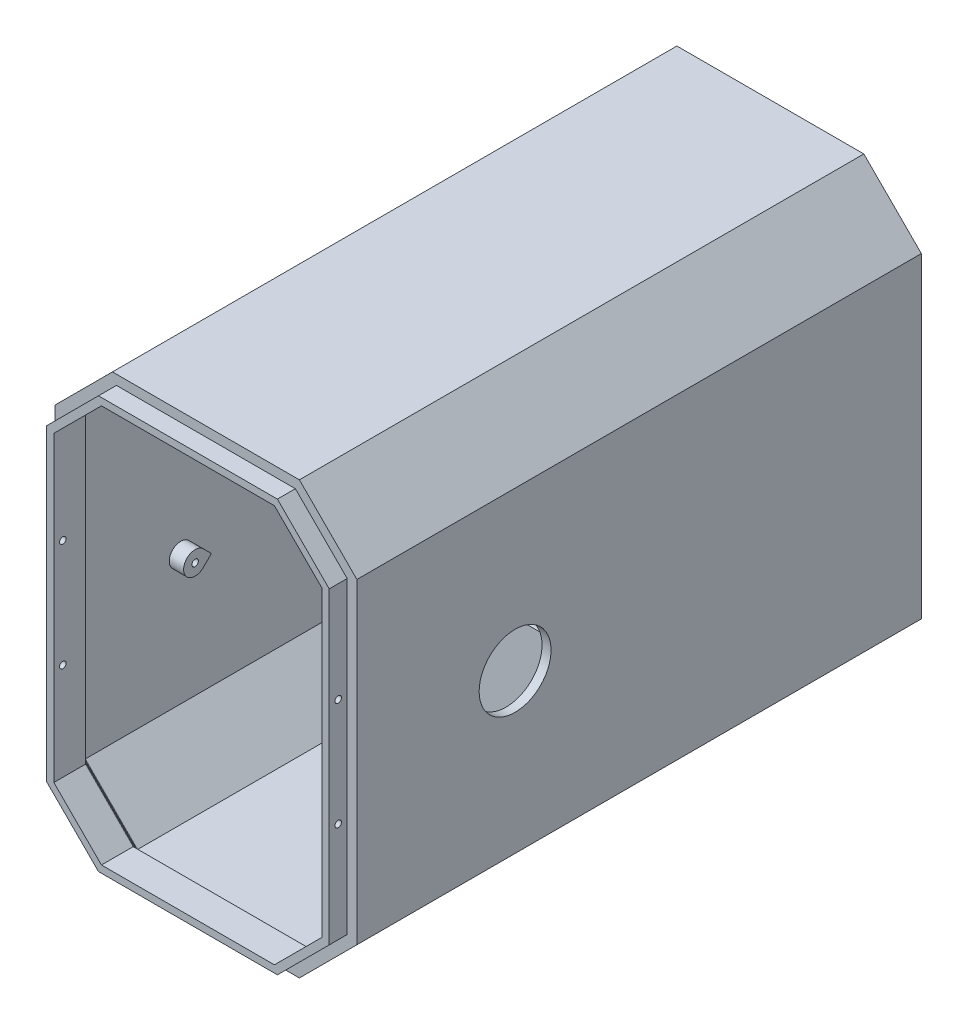
from build123d import *

# Parameters (mm, degrees)
BOSS_1_DEPTH    = 157
CUT_2_DEPTH     = 122.675
CUT_3_DEPTH     = 32.025
S_CUT4_W        = 8
S_CUT4_H        = 28
POCKET_4_DEPTH  = 2.7
S_HOLE5_R       = 6
HOLE_5_DEPTH    = 2.7
S_CUT6_W        = 19.4
S_CUT6_H        = 6.3
POCKET_6_DEPTH  = 2.7
S_CUT7_W        = 19.4
S_CUT7_H        = 6.3
POCKET_7_DEPTH  = 2.7
S_HOLE8_R       = 1.7
HOLE_8_DEPTH    = 2.7
S_HOLE9_R       = 1.7
HOLE_9_DEPTH    = 2.7
S_HOLE10_R      = 1.7
HOLE_10_DEPTH   = 2.7
S_HOLE11_R      = 1.7
HOLE_11_DEPTH   = 2.7
S_CUT12_W       = 10
S_CUT12_H       = 21.5
POCKET_12_DEPTH = 56.3
BOSS_13_DEPTH   = 6
BOSS_14_DEPTH   = 5.1
S_CYL15_R       = 3.2
BOSS_15_DEPTH   = 4.5
BOSS_16_DEPTH   = 4.5
S_CYL17_R       = 3.2
BOSS_17_DEPTH   = 4.5
BOSS_18_DEPTH   = 4.5
S_CYL19_R       = 3.2
BOSS_19_DEPTH   = 4.5
BOSS_20_DEPTH   = 4.5
S_CYL21_R       = 3.2
BOSS_21_DEPTH   = 4.5
BOSS_22_DEPTH   = 4.5
S_BOX23_W       = 25.8
S_BOX23_H       = 69
BOSS_23_DEPTH   = 6
BOSS_24_DEPTH   = 69
CUT_25_DEPTH    = 8.9
CUT_26_DEPTH    = 0.3
CUT_27_DEPTH    = 0.3
CUT_28_DEPTH    = 0.3
CUT_29_DEPTH    = 0.3
CUT_30_DEPTH    = 0.3
CUT_31_DEPTH    = 0.3
CUT_32_DEPTH    = 0.3
CUT_33_DEPTH    = 0.3
CUT_34_DEPTH    = 0.3
CUT_35_DEPTH    = 0.3
CUT_36_DEPTH    = 0.3
S_HOLE37_R      = 0.9
HOLE_37_DEPTH   = 2.7
S_HOLE38_R      = 0.9
HOLE_38_DEPTH   = 2.7
S_HOLE39_R      = 0.9
HOLE_39_DEPTH   = 2.7
S_HOLE40_R      = 0.9
HOLE_40_DEPTH   = 2.7
S_HOLE41_R      = 0.9
HOLE_41_DEPTH   = 5.2
S_HOLE42_R      = 0.9
HOLE_42_DEPTH   = 5.2
S_HOLE43_R      = 0.9
HOLE_43_DEPTH   = 5.2
S_HOLE44_R      = 0.9
HOLE_44_DEPTH   = 5.2
S_HOLE45_R      = 10
HOLE_45_DEPTH   = 3.1
S_CUT46_W       = 24.9
S_CUT46_H       = 10
POCKET_46_DEPTH = 4.1
S_HOLE47_R      = 0.9
HOLE_47_DEPTH   = 9.1
S_HOLE48_R      = 0.9
HOLE_48_DEPTH   = 9.1


with BuildPart() as part:
    # S_prism1 → Boss_1 (new body)
    with BuildSketch(Plane.XY.offset(37)):
        Polygon((42, -44), (42, 44), (26, 60), (-26, 60), (-42, 44), (-42, -44), (-26, -60), (26, -60), align=None)
    extrude(amount=BOSS_1_DEPTH)

    # S_pcut2 → Cut_2 (cut)
    with BuildSketch(Plane.XY.offset(71.425)):
        Polygon((39.5, -42.964466094), (39.5, 42.964466094), (24.964466094, 57.5), (-24.964466094, 57.5), (-39.5, 42.964466094), (-39.5, -42.964466094), (-24.964466094, -57.5), (24.964466094, -57.5), align=None)
    extrude(amount=CUT_2_DEPTH, mode=Mode.SUBTRACT)

    # S_pcut3 → Cut_3 (cut)
    with BuildSketch(Plane.XY.offset(36.9)):
        Polygon((39.5, -42.964466094), (39.5, 42.964466094), (24.964466094, 57.5), (-24.964466094, 57.5), (-39.5, 42.964466094), (-39.5, -42.964466094), (-24.964466094, -57.5), (24.964466094, -57.5), align=None)
    extrude(amount=CUT_3_DEPTH, mode=Mode.SUBTRACT)

    # S_cut4 → Pocket_4 (cut)
    with BuildSketch(Plane.XY.offset(68.825)):
        with Locations((-30, 0)):
            Rectangle(S_CUT4_W, S_CUT4_H)
    extrude(amount=POCKET_4_DEPTH, mode=Mode.SUBTRACT)

    # S_hole5 → Hole_5 (cut)
    with BuildSketch(Plane(origin=(-42.1, 0, 0), x_dir=(0, 0, -1), z_dir=(1, 0, 0))):
        with Locations((-88, 0)):
            Circle(S_HOLE5_R)
    extrude(amount=HOLE_5_DEPTH, mode=Mode.SUBTRACT)

    # S_cut6 → Pocket_6 (cut)
    with BuildSketch(Plane.XY.offset(68.825)):
        with Locations((0, 30.95)):
            Rectangle(S_CUT6_W, S_CUT6_H)
    extrude(amount=POCKET_6_DEPTH, mode=Mode.SUBTRACT)

    # S_cut7 → Pocket_7 (cut)
    with BuildSketch(Plane.XY.offset(68.825)):
        with Locations((0, -30.95)):
            Rectangle(S_CUT7_W, S_CUT7_H)
    extrude(amount=POCKET_7_DEPTH, mode=Mode.SUBTRACT)

    # S_hole8 → Hole_8 (cut)
    with BuildSketch(Plane.XY.offset(68.825)):
        with Locations((-20, -25)):
            Circle(S_HOLE8_R)
    extrude(amount=HOLE_8_DEPTH, mode=Mode.SUBTRACT)

    # S_hole9 → Hole_9 (cut)
    with BuildSketch(Plane.XY.offset(68.825)):
        with Locations((-20, 25)):
            Circle(S_HOLE9_R)
    extrude(amount=HOLE_9_DEPTH, mode=Mode.SUBTRACT)

    # S_hole10 → Hole_10 (cut)
    with BuildSketch(Plane.XY.offset(68.825)):
        with Locations((24, -25)):
            Circle(S_HOLE10_R)
    extrude(amount=HOLE_10_DEPTH, mode=Mode.SUBTRACT)

    # S_hole11 → Hole_11 (cut)
    with BuildSketch(Plane.XY.offset(68.825)):
        with Locations((24, 25)):
            Circle(S_HOLE11_R)
    extrude(amount=HOLE_11_DEPTH, mode=Mode.SUBTRACT)

    # S_cut12 → Pocket_12 (cut)
    with BuildSketch(Plane.XY.offset(104.2)):
        with Locations((-32.3, 50.25)):
            Rectangle(S_CUT12_W, S_CUT12_H)
    extrude(amount=POCKET_12_DEPTH, mode=Mode.SUBTRACT)

    # S_prism13 → Boss_13 (add)
    with BuildSketch(Plane.XY.offset(188)):
        Polygon((40, -43.171572875), (40, 43.171572875), (25.171572875, 58), (-25.171572875, 58), (-40, 43.171572875), (-40, -43.171572875), (-25.171572875, -58), (25.171572875, -58), align=None)
    extrude(amount=BOSS_13_DEPTH)

    # S_prism14 → Boss_14 (add)
    with BuildSketch(Plane.XY.offset(193.9)):
        Polygon((39.3, -42.881623382), (39.3, 42.881623382), (24.881623382, 57.3), (-24.881623382, 57.3), (-39.3, 42.881623382), (-39.3, -42.881623382), (-24.881623382, -57.3), (24.881623382, -57.3), align=None)
    extrude(amount=BOSS_14_DEPTH)

    # S_cyl15 → Boss_15 (add)
    with BuildSketch(Plane(origin=(-40, 0, 0), x_dir=(0, 0, -1), z_dir=(1, 0, 0))):
        with Locations((-103.5, 42)):
            Circle(S_CYL15_R)
    extrude(amount=BOSS_15_DEPTH)

    # S_prism16 → Boss_16 (add)
    with BuildSketch(Plane(origin=(-40, 0, 0), x_dir=(0, 0, -1), z_dir=(1, 0, 0))):
        Polygon((-101.24, 39.74), (-101.24, 44.26), (-98.97, 42), align=None)
    extrude(amount=BOSS_16_DEPTH)

    # S_cyl17 → Boss_17 (add)
    with BuildSketch(Plane(origin=(-40, 0, 0), x_dir=(0, 0, -1), z_dir=(1, 0, 0))):
        with Locations((-161.5, 42)):
            Circle(S_CYL17_R)
    extrude(amount=BOSS_17_DEPTH)

    # S_prism18 → Boss_18 (add)
    with BuildSketch(Plane(origin=(-40, 0, 0), x_dir=(0, 0, -1), z_dir=(1, 0, 0))):
        Polygon((-159.24, 39.74), (-159.24, 44.26), (-156.97, 42), align=None)
    extrude(amount=BOSS_18_DEPTH)

    # S_cyl19 → Boss_19 (add)
    with BuildSketch(Plane(origin=(-40, 0, 0), x_dir=(0, 0, -1), z_dir=(1, 0, 0))):
        with Locations((-103.5, -7)):
            Circle(S_CYL19_R)
    extrude(amount=BOSS_19_DEPTH)

    # S_prism20 → Boss_20 (add)
    with BuildSketch(Plane(origin=(-40, 0, 0), x_dir=(0, 0, -1), z_dir=(1, 0, 0))):
        Polygon((-101.24, -9.26), (-101.24, -4.74), (-98.97, -7), align=None)
    extrude(amount=BOSS_20_DEPTH)

    # S_cyl21 → Boss_21 (add)
    with BuildSketch(Plane(origin=(-40, 0, 0), x_dir=(0, 0, -1), z_dir=(1, 0, 0))):
        with Locations((-161.5, -7)):
            Circle(S_CYL21_R)
    extrude(amount=BOSS_21_DEPTH)

    # S_prism22 → Boss_22 (add)
    with BuildSketch(Plane(origin=(-40, 0, 0), x_dir=(0, 0, -1), z_dir=(1, 0, 0))):
        Polygon((-159.24, -9.26), (-159.24, -4.74), (-156.97, -7), align=None)
    extrude(amount=BOSS_22_DEPTH)

    # S_box23 → Boss_23 (add)
    with BuildSketch(Plane.XY.offset(126.2)):
        with Locations((27.1, 0)):
            Rectangle(S_BOX23_W, S_BOX23_H)
    extrude(amount=BOSS_23_DEPTH)

    # S_prism24 → Boss_24 (add)
    with BuildSketch(Plane(origin=(0, -34.5, 0), x_dir=(1, 0, 0), z_dir=(0, 1, 0))):
        Polygon((14.2, -126.25), (40, -126.25), (40, -100.4), align=None)
    extrude(amount=BOSS_24_DEPTH)

    # S_pcut25 → Cut_25 (cut)
    with BuildSketch(Plane.XY.offset(190.2)):
        Polygon((37.3, -42.053196257), (37.3, 42.053196257), (24.053196257, 55.3), (-24.053196257, 55.3), (-37.3, 42.053196257), (-37.3, -42.053196257), (-24.053196257, -55.3), (24.053196257, -55.3), align=None)
    extrude(amount=CUT_25_DEPTH, mode=Mode.SUBTRACT)

    # S_pcut26 → Cut_26 (cut)
    with BuildSketch(Plane.XY.offset(187.9)):
        Polygon((39.48, -42.956181823), (39.48, 42.956181823), (24.956181823, 57.48), (-24.956181823, 57.48), (-39.48, 42.956181823), (-39.48, -42.956181823), (-24.956181823, -57.48), (24.956181823, -57.48), align=None)
    extrude(amount=CUT_26_DEPTH, mode=Mode.SUBTRACT)

    # S_pcut27 → Cut_27 (cut)
    with BuildSketch(Plane.XY.offset(188.1)):
        Polygon((39.28, -42.87333911), (39.28, 42.87333911), (24.87333911, 57.28), (-24.87333911, 57.28), (-39.28, 42.87333911), (-39.28, -42.87333911), (-24.87333911, -57.28), (24.87333911, -57.28), align=None)
    extrude(amount=CUT_27_DEPTH, mode=Mode.SUBTRACT)

    # S_pcut28 → Cut_28 (cut)
    with BuildSketch(Plane.XY.offset(188.3)):
        Polygon((39.08, -42.790496398), (39.08, 42.790496398), (24.790496398, 57.08), (-24.790496398, 57.08), (-39.08, 42.790496398), (-39.08, -42.790496398), (-24.790496398, -57.08), (24.790496398, -57.08), align=None)
    extrude(amount=CUT_28_DEPTH, mode=Mode.SUBTRACT)

    # S_pcut29 → Cut_29 (cut)
    with BuildSketch(Plane.XY.offset(188.5)):
        Polygon((38.88, -42.707653685), (38.88, 42.707653685), (24.707653685, 56.88), (-24.707653685, 56.88), (-38.88, 42.707653685), (-38.88, -42.707653685), (-24.707653685, -56.88), (24.707653685, -56.88), align=None)
    extrude(amount=CUT_29_DEPTH, mode=Mode.SUBTRACT)

    # S_pcut30 → Cut_30 (cut)
    with BuildSketch(Plane.XY.offset(188.7)):
        Polygon((38.68, -42.624810973), (38.68, 42.624810973), (24.624810973, 56.68), (-24.624810973, 56.68), (-38.68, 42.624810973), (-38.68, -42.624810973), (-24.624810973, -56.68), (24.624810973, -56.68), align=None)
    extrude(amount=CUT_30_DEPTH, mode=Mode.SUBTRACT)

    # S_pcut31 → Cut_31 (cut)
    with BuildSketch(Plane.XY.offset(188.9)):
        Polygon((38.48, -42.54196826), (38.48, 42.54196826), (24.54196826, 56.48), (-24.54196826, 56.48), (-38.48, 42.54196826), (-38.48, -42.54196826), (-24.54196826, -56.48), (24.54196826, -56.48), align=None)
    extrude(amount=CUT_31_DEPTH, mode=Mode.SUBTRACT)

    # S_pcut32 → Cut_32 (cut)
    with BuildSketch(Plane.XY.offset(189.1)):
        Polygon((38.28, -42.459125548), (38.28, 42.459125548), (24.459125548, 56.28), (-24.459125548, 56.28), (-38.28, 42.459125548), (-38.28, -42.459125548), (-24.459125548, -56.28), (24.459125548, -56.28), align=None)
    extrude(amount=CUT_32_DEPTH, mode=Mode.SUBTRACT)

    # S_pcut33 → Cut_33 (cut)
    with BuildSketch(Plane.XY.offset(189.3)):
        Polygon((38.08, -42.376282835), (38.08, 42.376282835), (24.376282835, 56.08), (-24.376282835, 56.08), (-38.08, 42.376282835), (-38.08, -42.376282835), (-24.376282835, -56.08), (24.376282835, -56.08), align=None)
    extrude(amount=CUT_33_DEPTH, mode=Mode.SUBTRACT)

    # S_pcut34 → Cut_34 (cut)
    with BuildSketch(Plane.XY.offset(189.5)):
        Polygon((37.88, -42.293440123), (37.88, 42.293440123), (24.293440123, 55.88), (-24.293440123, 55.88), (-37.88, 42.293440123), (-37.88, -42.293440123), (-24.293440123, -55.88), (24.293440123, -55.88), align=None)
    extrude(amount=CUT_34_DEPTH, mode=Mode.SUBTRACT)

    # S_pcut35 → Cut_35 (cut)
    with BuildSketch(Plane.XY.offset(189.7)):
        Polygon((37.68, -42.210597411), (37.68, 42.210597411), (24.210597411, 55.68), (-24.210597411, 55.68), (-37.68, 42.210597411), (-37.68, -42.210597411), (-24.210597411, -55.68), (24.210597411, -55.68), align=None)
    extrude(amount=CUT_35_DEPTH, mode=Mode.SUBTRACT)

    # S_pcut36 → Cut_36 (cut)
    with BuildSketch(Plane.XY.offset(189.9)):
        Polygon((37.48, -42.127754698), (37.48, 42.127754698), (24.127754698, 55.48), (-24.127754698, 55.48), (-37.48, 42.127754698), (-37.48, -42.127754698), (-24.127754698, -55.48), (24.127754698, -55.48), align=None)
    extrude(amount=CUT_36_DEPTH, mode=Mode.SUBTRACT)

    # S_hole37 → Hole_37 (cut)
    with BuildSketch(Plane(origin=(37.1, 0, 0), x_dir=(0, 0, -1), z_dir=(1, 0, 0))):
        with Locations((-196.5, -15)):
            Circle(S_HOLE37_R)
    extrude(amount=HOLE_37_DEPTH, mode=Mode.SUBTRACT)

    # S_hole38 → Hole_38 (cut)
    with BuildSketch(Plane(origin=(37.1, 0, 0), x_dir=(0, 0, -1), z_dir=(1, 0, 0))):
        with Locations((-196.5, 15)):
            Circle(S_HOLE38_R)
    extrude(amount=HOLE_38_DEPTH, mode=Mode.SUBTRACT)

    # S_hole39 → Hole_39 (cut)
    with BuildSketch(Plane(origin=(-39.8, 0, 0), x_dir=(0, 0, -1), z_dir=(1, 0, 0))):
        with Locations((-196.5, -15)):
            Circle(S_HOLE39_R)
    extrude(amount=HOLE_39_DEPTH, mode=Mode.SUBTRACT)

    # S_hole40 → Hole_40 (cut)
    with BuildSketch(Plane(origin=(-39.8, 0, 0), x_dir=(0, 0, -1), z_dir=(1, 0, 0))):
        with Locations((-196.5, 15)):
            Circle(S_HOLE40_R)
    extrude(amount=HOLE_40_DEPTH, mode=Mode.SUBTRACT)

    # S_hole41 → Hole_41 (cut)
    with BuildSketch(Plane(origin=(-40.6, 0, 0), x_dir=(0, 0, -1), z_dir=(1, 0, 0))):
        with Locations((-103.5, 42)):
            Circle(S_HOLE41_R)
    extrude(amount=HOLE_41_DEPTH, mode=Mode.SUBTRACT)

    # S_hole42 → Hole_42 (cut)
    with BuildSketch(Plane(origin=(-40.6, 0, 0), x_dir=(0, 0, -1), z_dir=(1, 0, 0))):
        with Locations((-161.5, 42)):
            Circle(S_HOLE42_R)
    extrude(amount=HOLE_42_DEPTH, mode=Mode.SUBTRACT)

    # S_hole43 → Hole_43 (cut)
    with BuildSketch(Plane(origin=(-40.6, 0, 0), x_dir=(0, 0, -1), z_dir=(1, 0, 0))):
        with Locations((-103.5, -7)):
            Circle(S_HOLE43_R)
    extrude(amount=HOLE_43_DEPTH, mode=Mode.SUBTRACT)

    # S_hole44 → Hole_44 (cut)
    with BuildSketch(Plane(origin=(-40.6, 0, 0), x_dir=(0, 0, -1), z_dir=(1, 0, 0))):
        with Locations((-161.5, -7)):
            Circle(S_HOLE44_R)
    extrude(amount=HOLE_44_DEPTH, mode=Mode.SUBTRACT)

    # S_hole45 → Hole_45 (cut)
    with BuildSketch(Plane(origin=(39, 0, 0), x_dir=(0, 0, -1), z_dir=(1, 0, 0))):
        with Locations((-150, 0)):
            Circle(S_HOLE45_R)
    extrude(amount=HOLE_45_DEPTH, mode=Mode.SUBTRACT)

    # S_cut46 → Pocket_46 (cut)
    with BuildSketch(Plane.XY.offset(128.2)):
        with Locations((26.55, 0)):
            Rectangle(S_CUT46_W, S_CUT46_H)
    extrude(amount=POCKET_46_DEPTH, mode=Mode.SUBTRACT)

    # S_hole47 → Hole_47 (cut)
    with BuildSketch(Plane(origin=(14.1, 0, 0), x_dir=(0, 0, -1), z_dir=(1, 0, 0))):
        with Locations((-129.2, -22)):
            Circle(S_HOLE47_R)
    extrude(amount=HOLE_47_DEPTH, mode=Mode.SUBTRACT)

    # S_hole48 → Hole_48 (cut)
    with BuildSketch(Plane(origin=(14.1, 0, 0), x_dir=(0, 0, -1), z_dir=(1, 0, 0))):
        with Locations((-129.2, 22)):
            Circle(S_HOLE48_R)
    extrude(amount=HOLE_48_DEPTH, mode=Mode.SUBTRACT)


solid = part.part
